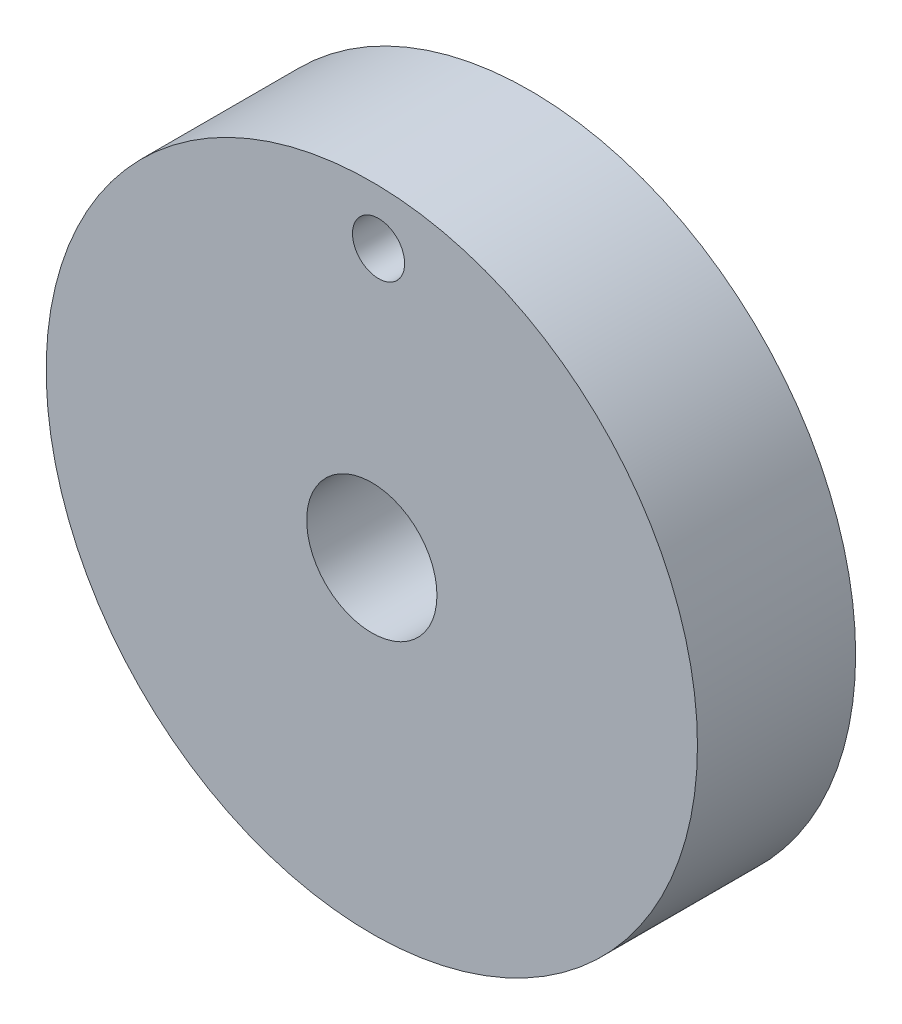
from build123d import *

# Parameters (mm, degrees)
SKETCH1_R           = 18
BOSS_EXTRUDE1_DEPTH = 20
SKETCH2_R           = 7
CUT_EXTRUDE1_DEPTH  = 60
SKETCH4_R           = 35
SKETCH4_R_2         = 14.576002813
BOSS_EXTRUDE2_DEPTH = 17
SKETCH5_R           = 2.802886509
CUT_EXTRUDE2_DEPTH  = 4


with BuildPart() as part:
    # Sketch1 → Boss-Extrude1 (new body)
    with BuildSketch(Plane.XY):
        Circle(SKETCH1_R)
    extrude(amount=BOSS_EXTRUDE1_DEPTH)

    # Sketch2 → Cut-Extrude1 (cut)
    with BuildSketch(Plane.XY.offset(20)):
        Circle(SKETCH2_R)
    extrude(amount=-CUT_EXTRUDE1_DEPTH, mode=Mode.SUBTRACT)

    # Sketch4 → Boss-Extrude2 (add)
    with BuildSketch(Plane.XY.offset(20)):
        Circle(SKETCH4_R)
        Circle(SKETCH4_R_2, mode=Mode.SUBTRACT)
    extrude(amount=-BOSS_EXTRUDE2_DEPTH)

    # Sketch5 → Cut-Extrude2 (cut)
    with BuildSketch(Plane.XY.offset(20)):
        with Locations((0.724287197, 29.141908403)):
            Circle(SKETCH5_R)
    extrude(amount=-CUT_EXTRUDE2_DEPTH, mode=Mode.SUBTRACT)


solid = part.part
